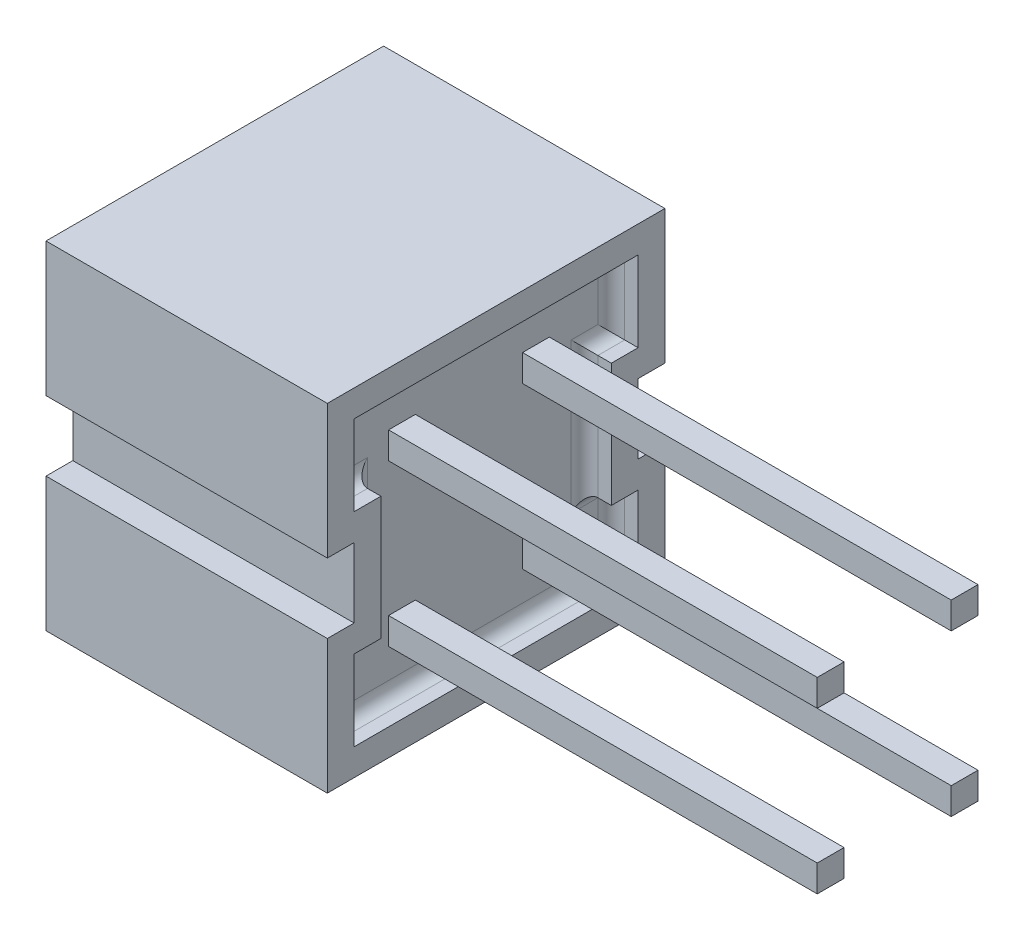
from build123d import *

# Parameters (mm, degrees)
SALIENTE_EXTRUIR1_DEPTH = 5.25
CORTAR_EXTRUIR1_DEPTH   = 1
CORTAR_EXTRUIR2_DEPTH   = 0.5
REDONDEO1_R             = 0.25
CROQUIS4_W              = 0.5
CROQUIS4_H              = 0.5
SALIENTE_EXTRUIR2_DEPTH = 8
CROQUIS5_R              = 1
CORTAR_EXTRUIR3_DEPTH   = 0.5
C_PULA1_FACE_RADIUS     = 1
C_PULA1_HEIGHT          = 1


# Read off the part's stored shape, not the designer's step: Cúpula2
with BuildPart() as part:
    # Croquis2 → Saliente-Extruir1 (new body)
    with BuildSketch(Plane(origin=(0, 0, 0), x_dir=(0, 0, -1), z_dir=(1, 0, 0))):
        Polygon((-3.15, -3.15), (3.15, -3.15), (3.15, -0.65), (2.65, -0.65), (2.65, 0.65), (3.15, 0.65), (3.15, 3.15), (-3.15, 3.15), (-3.15, 0.65), (-2.65, 0.65), (-2.65, -0.65), (-3.15, -0.65), align=None)
    extrude(amount=SALIENTE_EXTRUIR1_DEPTH)

    # Croquis2<4> → Cortar-Extruir1 (cut)
    with BuildSketch(Plane(origin=(0, 0, 0), x_dir=(0, 0, -1), z_dir=(1, 0, 0))):
        Polygon((-2.65, -2.65), (-2.65, -1.15), (-2.15, -1.15), (-2.15, 1.15), (-2.65, 1.15), (-2.65, 2.65), (2.65, 2.65), (2.65, 1.15), (2.15, 1.15), (2.15, -1.15), (2.65, -1.15), (2.65, -2.65), align=None)
    extrude(amount=CORTAR_EXTRUIR1_DEPTH, mode=Mode.SUBTRACT)

    # Croquis3 → Cortar-Extruir2 (cut)
    with BuildSketch(Plane(origin=(5.25, 0, 0), x_dir=(0, 0, -1), z_dir=(1, 0, 0))):
        Polygon((2.65, 1.15), (2.65, 2.65), (-2.65, 2.65), (-2.65, 1.15), (-2.15, 1.15), (-2.15, -1.15), (-2.65, -1.15), (-2.65, -2.65), (2.65, -2.65), (2.65, -1.15), (2.15, -1.15), (2.15, 1.15), align=None)
    extrude(amount=-CORTAR_EXTRUIR2_DEPTH, mode=Mode.SUBTRACT)

    # Redondeo1
    redondeo1_edges = [part.edges().sort_by_distance(p)[0] for p in [
        (4.75, 1.9, -2.65),
        (4.75, 1.15, -2.4),
        (4.75, 0, -2.15),
        (4.75, -1.15, -2.4),
        (4.75, -1.9, -2.65),
        (4.75, -2.65, 0),
        (4.75, -1.9, 2.65),
        (4.75, -1.15, 2.4),
        (4.75, 0, 2.15),
        (4.75, 1.15, 2.4),
        (4.75, 1.9, 2.65),
        (4.75, 2.65, 0),
    ]]
    fillet(redondeo1_edges, radius=REDONDEO1_R)

    # Croquis4 → Saliente-Extruir2 (add)
    with BuildSketch(Plane(origin=(4.75, 0, 0), x_dir=(0, 0, -1), z_dir=(1, 0, 0))):
        with Locations((-1.256816684, 1.4)):
            Rectangle(CROQUIS4_W, CROQUIS4_H)
        with Locations((1.243183316, 1.4)):
            Rectangle(CROQUIS4_W, CROQUIS4_H)
        with Locations((1.243183316, -1.6)):
            Rectangle(CROQUIS4_W, CROQUIS4_H)
        with Locations((-1.256816684, -1.6)):
            Rectangle(CROQUIS4_W, CROQUIS4_H)
    extrude(amount=SALIENTE_EXTRUIR2_DEPTH)

    # Croquis5 → Cortar-Extruir3 (cut)
    with BuildSketch(Plane.ZY.offset(-1)):
        with Locations((0, 1.5)):
            Circle(CROQUIS5_R)
        with Locations(Location((0, -1.5, 0), (0, 0, 180))):
            Circle(CROQUIS5_R)
    extrude(amount=-CORTAR_EXTRUIR3_DEPTH, mode=Mode.SUBTRACT)

    # Cúpula1: a dome of height H over a round flat face of radius A is a cap of a sphere of radius (A * A + H * H) / (2 * H)
    c_pula1_r = (C_PULA1_FACE_RADIUS * C_PULA1_FACE_RADIUS + C_PULA1_HEIGHT * C_PULA1_HEIGHT) / (2 * C_PULA1_HEIGHT)
    c_pula1_base = Plane((1.5, 1.5, 0), z_dir=(-1, 0, 0))
    with Locations(c_pula1_base.offset(C_PULA1_HEIGHT - c_pula1_r)):
        c_pula1_ball = Sphere(c_pula1_r, mode=Mode.PRIVATE)
    add(split(c_pula1_ball, bisect_by=c_pula1_base, keep=Keep.TOP, mode=Mode.PRIVATE))

    # Cúpula2 outline → Cúpula2 (revolve)
    with BuildSketch(Plane(origin=(0, -1.5, 0), x_dir=(0, 1, 0), z_dir=(0, 0, -1))):
        with BuildLine():
            Line((0, 1.500000001), (0, 0.5))
            ThreePointArc((0, 0.5), (0.707106782, 0.792893219), (1, 1.500000001))
            Line((1, 1.500000001), (0, 1.500000001))
        make_face()
    revolve(axis=Axis((0, -1.5, 0), (1, 0, 0)))


solid = part.part
